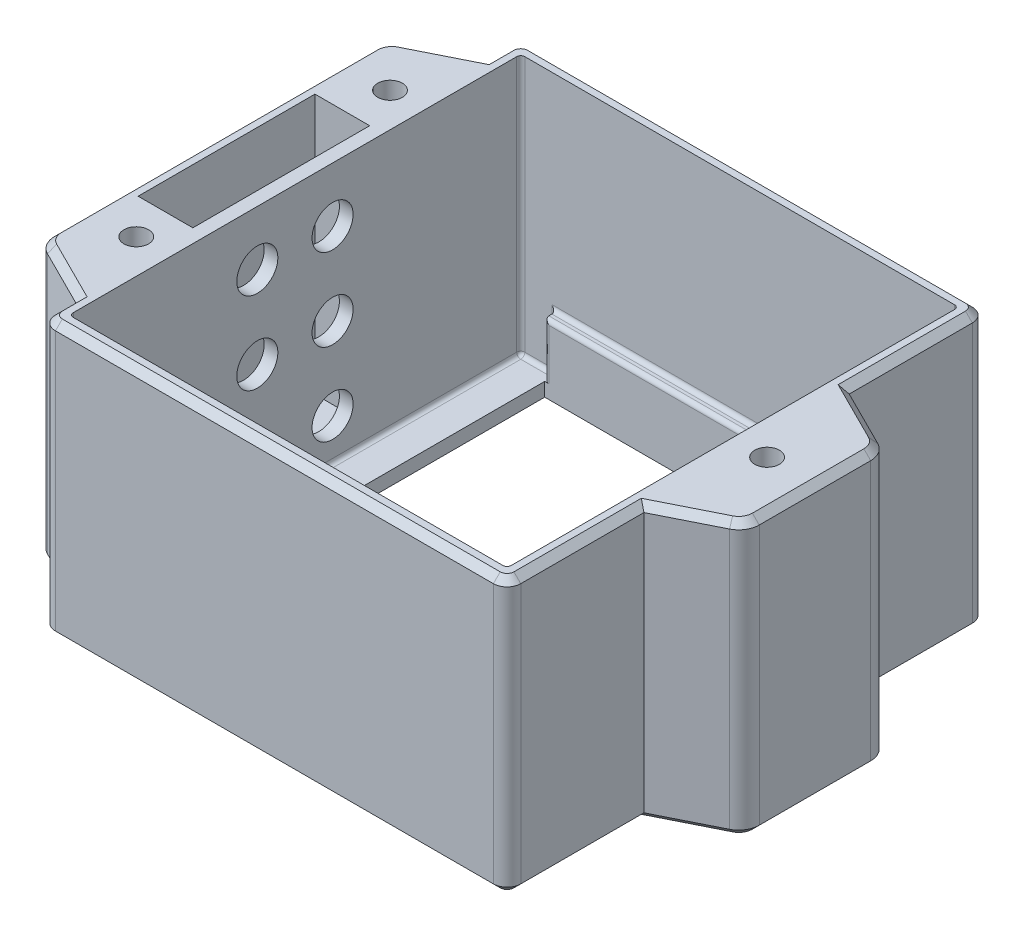
from build123d import *

# Parameters (mm, degrees)
BOSS_EXTRUDE1_DEPTH = 40
SHELL1_START        = -33
SHELL1_OUTLINE_W    = 64
SHELL1_OUTLINE_H    = 38
SHELL1_DEPTH        = 66
SKETCH2_R           = 1.8
BOSS_EXTRUDE2_DEPTH = 40
CUT_EXTRUDE1_START  = 40
SKETCH3_W           = 8
SKETCH3_H           = 25.845374508
CUT_EXTRUDE1_DEPTH  = 38
SKETCH4_R           = 3
CUT_EXTRUDE2_DEPTH  = 2
SKETCH5_W           = 57.25
SKETCH5_H           = 62.7
CUT_EXTRUDE3_DEPTH  = 2
BOSS_EXTRUDE3_DEPTH = 8
CHAMFER1_SIZE       = 1
FILLET1_R           = 0.6


# Read off the part's stored shape, not the designer's step: Shell1
with BuildPart() as part:
    # Sketch1 → Boss-Extrude1 (new body)
    with BuildSketch(Plane(origin=(0, 0, 0), x_dir=(1, 0, 0), z_dir=(0, 1, 0))):
        with BuildLine():
            Line((-32, 35), (32, 35))
            ThreePointArc((32, 35), (33.414213562, 34.414213562), (34, 33))
            Line((34, 33), (34, -33))
            ThreePointArc((34, -33), (33.414213562, -34.414213562), (32, -35))
            Line((32, -35), (-32, -35))
            ThreePointArc((-32, -35), (-33.414213562, -34.414213562), (-34, -33))
            Line((-34, -33), (-34, 33))
            ThreePointArc((-34, 33), (-33.414213562, 34.414213562), (-32, 35))
        make_face()
    extrude(amount=BOSS_EXTRUDE1_DEPTH)

    # Shell1 outline → Shell1 (cut)
    with BuildSketch(Plane.XY.offset(SHELL1_START)):
        with Locations((0, 21)):
            Rectangle(SHELL1_OUTLINE_W, SHELL1_OUTLINE_H)
    extrude(amount=SHELL1_DEPTH, mode=Mode.SUBTRACT)

    # Sketch2 → Boss-Extrude2 (add)
    # profile 1 of 2: a face of its own
    with BuildSketch(Plane(origin=(0, 0, 0), x_dir=(1, 0, 0), z_dir=(0, 1, 0))):
        with BuildLine():
            Line((-34, 30), (-42.341640786, 25.829179607))
            ThreePointArc((-42.341640786, 25.829179607), (-43.551952425, 24.72309137), (-44, 23.145898034))
            Line((-44, 23.145898034), (-44, -23.145898034))
            ThreePointArc((-44, -23.145898034), (-43.551952425, -24.72309137), (-42.341640786, -25.829179607))
            Line((-42.341640786, -25.829179607), (-34, -30))
            Line((-34, -30), (-34, 30))
        make_face()
        with Locations(Location((-37, 18.896413475, 0), (0, 0, 90))):
            Circle(SKETCH2_R, mode=Mode.SUBTRACT)
        with Locations(Location((-37, -18.192906379, 0), (0, 0, 90))):
            Circle(SKETCH2_R, mode=Mode.SUBTRACT)
    # profile 2 of 2: a face of its own
    with BuildSketch(Plane(origin=(0, 0, 0), x_dir=(1, 0, 0), z_dir=(0, 1, 0))):
        with BuildLine():
            Line((34, 15), (42.341640786, 10.829179607))
            ThreePointArc((42.341640786, 10.829179607), (43.551952425, 9.72309137), (44, 8.145898034))
            Line((44, 8.145898034), (44, -8.145898034))
            ThreePointArc((44, -8.145898034), (43.551952425, -9.72309137), (42.341640786, -10.829179607))
            Line((42.341640786, -10.829179607), (34, -15))
            Line((34, -15), (34, 15))
        make_face()
        with Locations(Location((37, 0, 0), (0, 0, 90))):
            Circle(SKETCH2_R, mode=Mode.SUBTRACT)
    extrude(amount=BOSS_EXTRUDE2_DEPTH)

    # Sketch3 → Cut-Extrude1 (cut)
    with BuildSketch(Plane(origin=(0, 0, 0), x_dir=(1, 0, 0), z_dir=(0, 1, 0)).offset(CUT_EXTRUDE1_START)):
        with Locations((-38, 0)):
            Rectangle(SKETCH3_W, SKETCH3_H)
    extrude(amount=-CUT_EXTRUDE1_DEPTH, mode=Mode.SUBTRACT)

    # Sketch4 → Cut-Extrude2 (cut)
    with BuildSketch(Plane.ZY.offset(34)):
        with Locations((-5.5, 32)):
            Circle(SKETCH4_R)
        with Locations((5.5, 32)):
            Circle(SKETCH4_R)
        with Locations((-5.5, 20)):
            Circle(SKETCH4_R)
        with Locations((5.5, 20)):
            Circle(SKETCH4_R)
        with Locations((-5.5, 8)):
            Circle(SKETCH4_R)
        with Locations((5.5, 8)):
            Circle(SKETCH4_R)
    extrude(amount=-CUT_EXTRUDE2_DEPTH, mode=Mode.SUBTRACT)

    # Sketch5 → Cut-Extrude3 (cut)
    with BuildSketch(Plane(origin=(0, 0, 0), x_dir=(1, 0, 0), z_dir=(0, 1, 0))):
        with Locations((1.775, 0)):
            Rectangle(SKETCH5_W, SKETCH5_H)
    extrude(amount=CUT_EXTRUDE3_DEPTH, mode=Mode.SUBTRACT)

    # Sketch6 → Boss-Extrude3 (add)
    with BuildSketch(Plane(origin=(0, 2, 0), x_dir=(1, 0, 0), z_dir=(0, 1, 0))):
        Polygon((-26.85, 31.35), (-26.85, 33), (32, 33), (32, -33), (-26.85, -33), (-26.85, -31.35), (30.4, -31.35), (30.4, 31.35), align=None)
    extrude(amount=BOSS_EXTRUDE3_DEPTH)

    # Chamfer1
    chamfer1_edges = [part.edges().sort_by_distance(p)[0] for p in [
        (-34, 0, -31.5),
        (-33.414213562, 0, -34.414213562),
        (0, 0, -35),
        (33.414213562, 0, -34.414213562),
        (-33.414213562, 40, -34.414213562),
        (-34, 40, -31.5),
        (-33.414213562, 40, 34.414213562),
        (0, 40, 35),
        (33.414213562, 40, 34.414213562),
        (34, 40, 24),
        (-34, 0, 31.5),
        (-34, 40, 31.5),
        (-38.170820393, 40, -27.914589803),
        (-38.170820393, 0, -27.914589803),
        (-43.551952425, 40, -24.72309137),
        (-43.551952425, 0, -24.72309137),
        (-44, 40, 0),
        (-44, 0, 0),
        (-43.551952425, 40, 24.72309137),
        (-43.551952425, 0, 24.72309137),
        (-38.170820393, 40, 27.914589803),
        (-38.170820393, 0, 27.914589803),
        (33.414213562, 40, -34.414213562),
        (34, 0, -24),
        (34, 40, -24),
        (38.170820393, 40, 12.914589803),
        (38.170820393, 0, 12.914589803),
        (43.551952425, 40, 9.72309137),
        (43.551952425, 0, 9.72309137),
        (44, 40, 0),
        (44, 0, 0),
        (43.551952425, 40, -9.72309137),
        (43.551952425, 0, -9.72309137),
        (38.170820393, 40, -12.914589803),
        (38.170820393, 0, -12.914589803),
        (34, 0, 24),
        (0, 40, -35),
        (33.414213562, 0, 34.414213562),
        (0, 0, 35),
        (-33.414213562, 0, 34.414213562),
    ]]
    chamfer(chamfer1_edges, length=CHAMFER1_SIZE)

    # Fillet1
    fillet1_edges = [part.edges().sort_by_distance(p)[0] for p in [
        (-29.425, 2, -33),
        (-26.85, 6, -31.35),
        (-26.85, 6, 31.35),
        (-26.85, 6, 33),
        (-26.85, 6, -33),
        (1.775, 10, -31.35),
        (30.4, 10, 0),
        (1.775, 10, 31.35),
        (2.575, 10, 33),
        (32, 10, 0),
        (2.575, 10, -33),
        (32, 25, -33),
        (-32, 2, 0),
        (-32, 21, -33),
        (-29.425, 2, 33),
        (-32, 21, 33),
        (32, 25, 33),
    ]]
    fillet(fillet1_edges, radius=FILLET1_R)


solid = part.part
